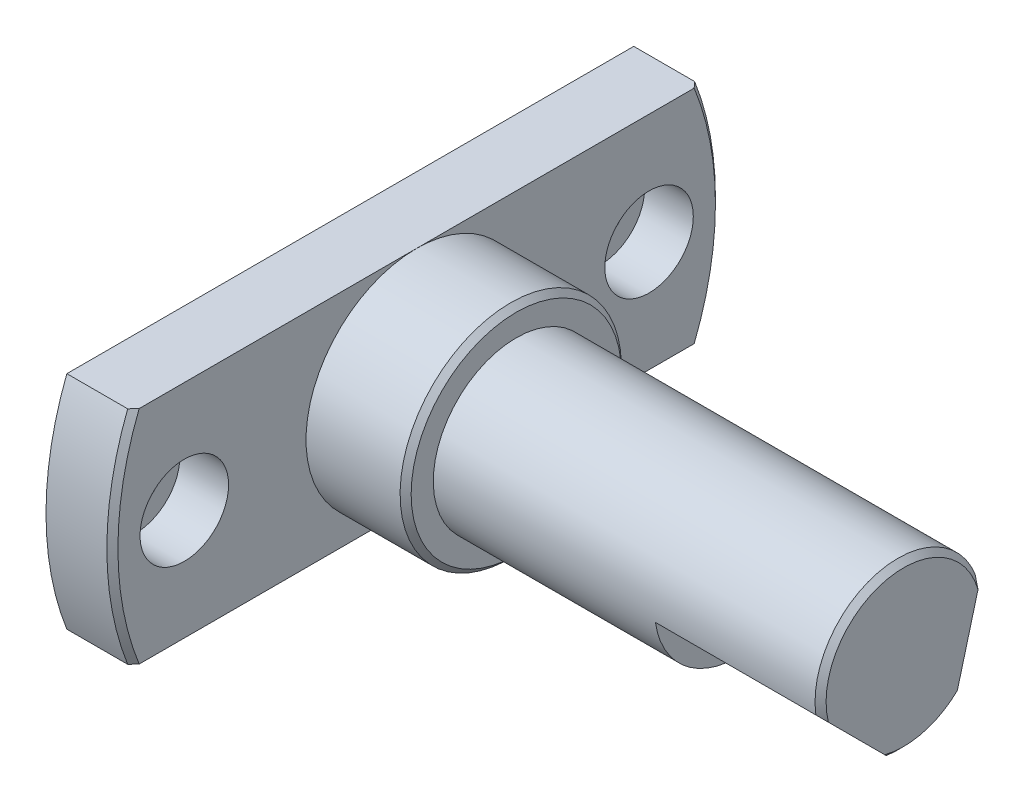
from build123d import *

# Parameters (mm, degrees)
CHANFREIN1_SIZE                                    = 0.5
CHAMBRAGE_POUR_VIS_T_TE_HEXAGONALE_M41_D           = 4.5
CHAMBRAGE_POUR_VIS_T_TE_HEXAGONALE_M41_CBORE_D     = 8
CHAMBRAGE_POUR_VIS_T_TE_HEXAGONALE_M41_CBORE_DEPTH = 4.4
ENL_V_MAT_EXTRU_1_DEPTH                            = 15
ENL_V_MAT_EXTRU_2_DEPTH                            = 64.344297297
CHANFREIN3_SIZE                                    = 0.5


with BuildPart() as part:
    # Esquisse1 → Révolution1 (revolve)
    with BuildSketch(Plane.XY):
        Polygon((15, 7.5), (50, 7.5), (50, 0), (0, 0), (0, 27.5), (6, 27.5), (6, 10), (15, 10), align=None)
    revolve(axis=Axis((50, 0, 0), (-1, 0, 0)))

    # Chanfrein1
    chanfrein1_edges = [part.edges().sort_by_distance(p)[0] for p in [
        (15, -10, 0),
        (6, -27.5, 0),
    ]]
    chamfer(chanfrein1_edges, length=CHANFREIN1_SIZE)

    # Chambrage pour vis à tête hexagonale M41 (through all)
    with Locations(Plane(origin=(6, 0, 0), x_dir=(0, 0, -1), z_dir=(1, 0, 0))):
        with Locations((-21, 0), (21, 0)):
            CounterBoreHole(CHAMBRAGE_POUR_VIS_T_TE_HEXAGONALE_M41_D / 2, CHAMBRAGE_POUR_VIS_T_TE_HEXAGONALE_M41_CBORE_D / 2, CHAMBRAGE_POUR_VIS_T_TE_HEXAGONALE_M41_CBORE_DEPTH)

    # Esquisse8 → Enlèv. mat.-Extru.1 (cut)
    with BuildSketch(Plane(origin=(50, 0, 0), x_dir=(0, 0, -1), z_dir=(1, 0, 0))):
        with BuildLine():
            Line((-1.060660172, -7.424621202), (-7.424621202, -1.060660172))
            ThreePointArc((-7.424621202, -1.060660172), (-5.303300859, -5.303300859), (-1.060660172, -7.424621202))
        make_face()
        with BuildLine():
            Line((4.630869255, -5.899580489), (6.960240661, 2.793751948))
            ThreePointArc((6.960240661, 2.793751948), (7.244443697, -1.941142838), (4.630869255, -5.899580489))
        make_face()
    extrude(amount=-ENL_V_MAT_EXTRU_1_DEPTH, mode=Mode.SUBTRACT)

    # Esquisse11 → Enlèv. mat.-Extru.2 (cut, through all)
    with BuildSketch(Plane.ZY):
        with BuildLine():
            Line((25.617376915, -10), (-25.617376915, -10))
            ThreePointArc((-25.617376915, -10), (0, -27.5), (25.617376915, -10))
        make_face()
        with BuildLine():
            Line((25.617376915, 10), (-25.617376915, 10))
            ThreePointArc((-25.617376915, 10), (0, 27.5), (25.617376915, 10))
        make_face()
    extrude(amount=-ENL_V_MAT_EXTRU_2_DEPTH, mode=Mode.SUBTRACT)

    # Chanfrein3
    chanfrein3_edges = [part.edges().sort_by_distance(p)[0] for p in [
        (50, -7.244443697, -1.941142838),
        (50, 4.91401306, 5.665904662),
    ]]
    chamfer(chanfrein3_edges, length=CHANFREIN3_SIZE)


solid = part.part
